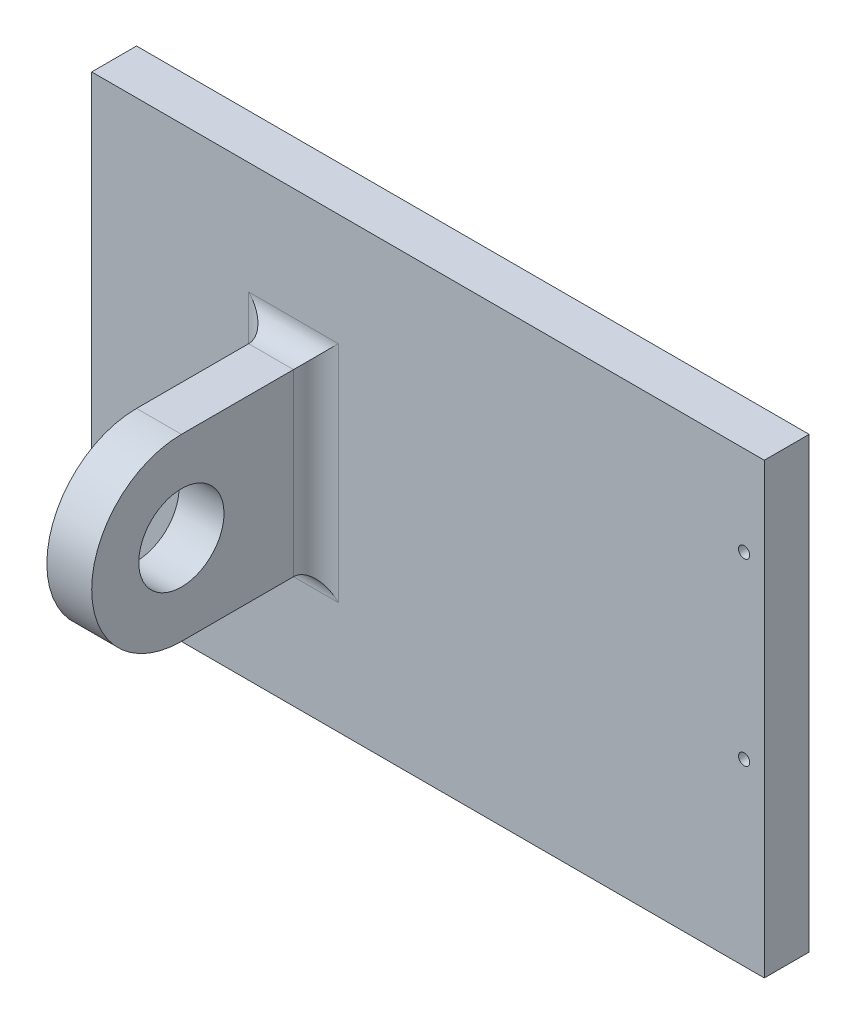
from build123d import *

# Parameters (mm, degrees)
SKETCH_2_W          = 150
SKETCH_2_H          = 100
EXTRUDE_1_DEPTH     = 10
SKETCH_3_W          = 10
SKETCH_3_H          = 40
EXTRUDE_2_DEPTH     = 40
SKETCH_4_R          = 20
EXTRUDE_3_DEPTH     = 10
SKETCH_5_R          = 9.5
CUT_EXTRUDE_1_DEPTH = 10
M3X0_5_2_D          = 2.5
FILLET_1_R          = 5


with BuildPart() as part:
    # ｽｹｯﾁ2 → ﾎﾞｽ - 押し出し1 (new body)
    with BuildSketch(Plane.XY):
        Rectangle(SKETCH_2_W, SKETCH_2_H)
    extrude(amount=EXTRUDE_1_DEPTH)

    # ｽｹｯﾁ3 → ﾎﾞｽ - 押し出し2 (add)
    with BuildSketch(Plane.XY):
        with Locations((-30, 0)):
            Rectangle(SKETCH_3_W, SKETCH_3_H)
    extrude(amount=EXTRUDE_2_DEPTH)

    # ｽｹｯﾁ4 → ﾎﾞｽ - 押し出し3 (add)
    with BuildSketch(Plane.ZY.offset(35)):
        with Locations((40, 0)):
            Circle(SKETCH_4_R)
    extrude(amount=-EXTRUDE_3_DEPTH)

    # ｽｹｯﾁ5 → ｶｯﾄ - 押し出し1 (cut)
    with BuildSketch(Plane.ZY.offset(35)):
        with Locations((40, 0)):
            Circle(SKETCH_5_R)
    extrude(amount=-CUT_EXTRUDE_1_DEPTH, mode=Mode.SUBTRACT)

    # M3x0.5 ねじ穴2 (through all)
    with Locations(Plane.XY.offset(10)):
        with Locations((70.5, -10.000898701), (70.5, 29.999101299)):
            Hole(M3X0_5_2_D / 2)

    # ﾌｨﾚｯﾄ1
    fillet_1_edges = [part.edges().sort_by_distance(p)[0] for p in [
        (-30, -20, 10),
        (-35, 0, 10),
        (-30, 20, 10),
        (-25, 0, 10),
    ]]
    fillet(fillet_1_edges, radius=FILLET_1_R)


solid = part.part
